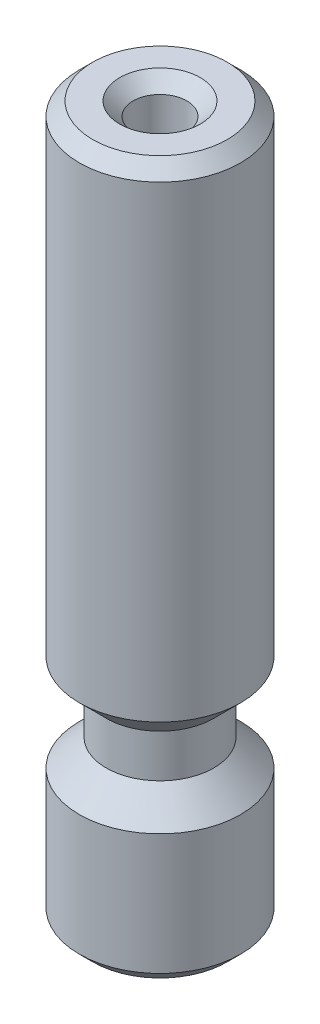
from build123d import *

# Parameters (mm, degrees)
SKETCH1_R           = 3
BOSS_EXTRUDE1_DEPTH = 26.5
SKETCH3_R           = 1
CUT_EXTRUDE1_DEPTH  = 27.837473801
CHAMFER1_SIZE       = 0.5


with BuildPart() as part:
    # Sketch1 → Boss-Extrude1 (new body)
    with BuildSketch(Plane(origin=(0, 0, 0), x_dir=(1, 0, 0), z_dir=(0, 1, 0))):
        Circle(SKETCH1_R)
    extrude(amount=BOSS_EXTRUDE1_DEPTH)

    # Sketch3 → Cut-Extrude1 (cut, through all)
    with BuildSketch(Plane(origin=(0, 26.5, 0), x_dir=(1, 0, 0), z_dir=(0, 1, 0))):
        Circle(SKETCH3_R)
    extrude(amount=-CUT_EXTRUDE1_DEPTH, mode=Mode.SUBTRACT)

    # Chamfer1
    chamfer1_edges = [part.edges().sort_by_distance(p)[0] for p in [
        (-3, 0, 0),
        (-1, 26.5, 0),
        (-3, 26.5, 0),
    ]]
    chamfer(chamfer1_edges, length=CHAMFER1_SIZE)

    # Sketch4 → Cut-Revolve1 (revolve, cut)
    with BuildSketch(Plane.XY):
        Polygon((3, 8.6), (2, 7.6), (2, 6), (3, 5), align=None)
    revolve(axis=Axis((0, 0, 0), (0, 1, 0)), mode=Mode.SUBTRACT)


solid = part.part
